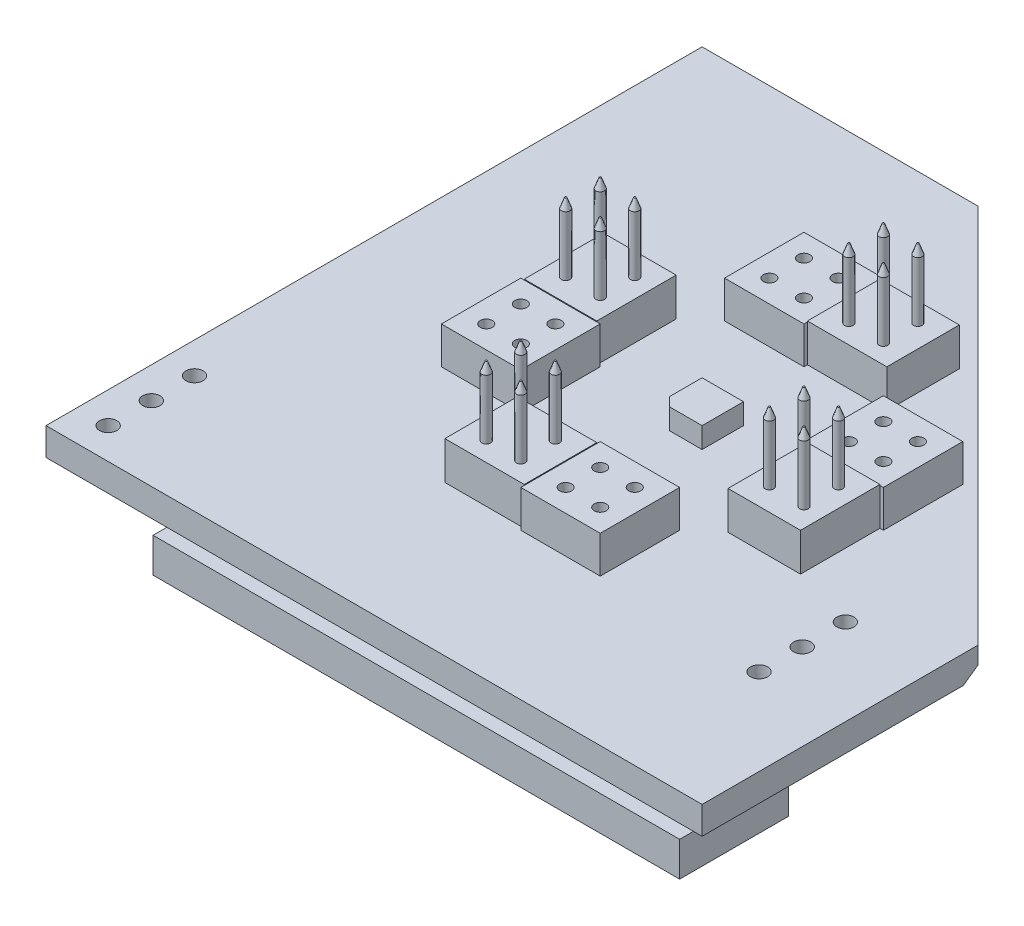
from build123d import *
from OCP.BRepFilletAPI import BRepFilletAPI_MakeChamfer
from build123d.topology import SkipClean

# Parameters (mm, degrees)
EXTRUDE1_DEPTH       = 1.6
SKETCH2_W            = 4.6
SKETCH2_H            = 4.6
EXTRUDE2_DEPTH       = 2.15
SKETCH3_W            = 4.6
SKETCH3_H            = 4.2
SKETCH3_W_2          = 4.2
SKETCH3_H_2          = 4.6
EXTRUDE3_DEPTH       = 2.2
SKETCH4_R            = 0.35
CUT_EXTRUDE1_DEPTH   = 2.15
SKETCH5_R            = 0.25
EXTRUDE4_DEPTH       = 4
CHAMFER1_SIZE        = 0.2
CHAMFER1_SIZE2       = 0.549495484
SKETCH6_W            = 30.5
SKETCH6_H            = 6.3
EXTRUDE5_DEPTH       = 2
CHAMFER2_SIZE        = 0.6
EXTRUDE7_DEPTH       = 1.2
SKETCH14_R           = 0.5
CUT_EXTRUDE2_DEPTH   = 29.528582159
EXTRUDE13_DEPTH      = 0.05
EXTRUDE13_DEPTH_BACK = 1.05
SKETCH15_R           = 0.95
SKETCH15_R_2         = 0.5
SKETCH21_W           = 3.25
SKETCH21_H           = 3.25
EXTRUDE19_DEPTH      = 1.1
SKETCH22_W           = 0.8
SKETCH22_H           = 1.6
SKETCH22_W_2         = 2
SKETCH22_H_2         = 1.3
EXTRUDE20_DEPTH      = 0.5


with BuildPart() as part:
    # Sketch1 → Extrude1 (new body)
    with BuildSketch(Plane(origin=(0, 0, 0), x_dir=(1, 0, 0), z_dir=(0, 1, 0))):
        Polygon((19, -3.019386745), (-3.019386745, 19), (-19, 19), (-19, -19), (19, -19), align=None)
    extrude(amount=EXTRUDE1_DEPTH)

    # Sketch2 → Extrude2 (add)
    with BuildSketch(Plane(origin=(0, 1.6, 0), x_dir=(-1, 0, 0), z_dir=(0, 1, 0))):
        with Locations((-8.2, -2.3)):
            Rectangle(SKETCH2_W, SKETCH2_H)
        with Locations((2.3, -8.2)):
            Rectangle(SKETCH2_W, SKETCH2_H)
        with Locations((-2.3, 8.2)):
            Rectangle(SKETCH2_W, SKETCH2_H)
        with Locations((8.2, 2.3)):
            Rectangle(SKETCH2_W, SKETCH2_H)
    extrude(amount=EXTRUDE2_DEPTH)

    # Sketch3 → Extrude3 (add)
    with BuildSketch(Plane(origin=(0, 1.6, 0), x_dir=(-1, 0, 0), z_dir=(0, 1, 0))):
        with Locations((-2.3, -8.2)):
            Rectangle(SKETCH3_W, SKETCH3_H)
        with Locations((-8.2, 2.3)):
            Rectangle(SKETCH3_W_2, SKETCH3_H_2)
        with Locations((2.3, 8.2)):
            Rectangle(SKETCH3_W, SKETCH3_H)
        with Locations((8.2, -2.3)):
            Rectangle(SKETCH3_W_2, SKETCH3_H_2)
    extrude(amount=EXTRUDE3_DEPTH)

    # Sketch4 → Cut-Extrude1 (cut)
    with BuildSketch(Plane(origin=(0, 3.75, 0), x_dir=(-1, 0, 0), z_dir=(0, 1, 0))):
        with Locations(Location((3.3, -9.2, 0), (0, 0, 90))):
            Circle(SKETCH4_R)
        with Locations(Location((1.3, -9.2, 0), (0, 0, 90))):
            Circle(SKETCH4_R)
        with Locations(Location((1.3, -7.2, 0), (0, 0, 90))):
            Circle(SKETCH4_R)
        with Locations(Location((3.3, -7.2, 0), (0, 0, 90))):
            Circle(SKETCH4_R)
        with Locations(Location((-9.2, -3.3, 0), (0, 0, 90))):
            Circle(SKETCH4_R)
        with Locations(Location((-9.2, -1.3, 0), (0, 0, 90))):
            Circle(SKETCH4_R)
        with Locations(Location((-7.2, -1.3, 0), (0, 0, 90))):
            Circle(SKETCH4_R)
        with Locations(Location((-7.2, -3.3, 0), (0, 0, 90))):
            Circle(SKETCH4_R)
        with Locations(Location((-3.3, 9.2, 0), (0, 0, 90))):
            Circle(SKETCH4_R)
        with Locations(Location((-1.3, 9.2, 0), (0, 0, 90))):
            Circle(SKETCH4_R)
        with Locations(Location((-1.3, 7.2, 0), (0, 0, 90))):
            Circle(SKETCH4_R)
        with Locations(Location((-3.3, 7.2, 0), (0, 0, 90))):
            Circle(SKETCH4_R)
        with Locations(Location((9.2, 3.3, 0), (0, 0, 90))):
            Circle(SKETCH4_R)
        with Locations(Location((9.2, 1.3, 0), (0, 0, 90))):
            Circle(SKETCH4_R)
        with Locations(Location((7.2, 1.3, 0), (0, 0, 90))):
            Circle(SKETCH4_R)
        with Locations(Location((7.2, 3.3, 0), (0, 0, 90))):
            Circle(SKETCH4_R)
    extrude(amount=-CUT_EXTRUDE1_DEPTH, mode=Mode.SUBTRACT)

    # Sketch5 → Extrude4 (add)
    with BuildSketch(Plane(origin=(0, 3.8, 0), x_dir=(-1, 0, 0), z_dir=(0, 1, 0))):
        with Locations(Location((-1.3, -9.2, 0), (0, 0, 270))):
            Circle(SKETCH5_R)
        with Locations(Location((-3.3, -9.2, 0), (0, 0, 270))):
            Circle(SKETCH5_R)
        with Locations(Location((-3.3, -7.2, 0), (0, 0, 270))):
            Circle(SKETCH5_R)
        with Locations(Location((-1.3, -7.2, 0), (0, 0, 270))):
            Circle(SKETCH5_R)
        with Locations(Location((-7.2, 1.3, 0), (0, 0, 270))):
            Circle(SKETCH5_R)
        with Locations(Location((-9.2, 1.3, 0), (0, 0, 90))):
            Circle(SKETCH5_R)
        with Locations(Location((-9.2, 3.3, 0), (0, 0, 270))):
            Circle(SKETCH5_R)
        with Locations(Location((-7.2, 3.3, 0), (0, 0, 90))):
            Circle(SKETCH5_R)
        with Locations(Location((1.3, 7.2, 0), (0, 0, 270))):
            Circle(SKETCH5_R)
        with Locations(Location((1.3, 9.2, 0), (0, 0, 90))):
            Circle(SKETCH5_R)
        with Locations(Location((3.3, 9.2, 0), (0, 0, 270))):
            Circle(SKETCH5_R)
        with Locations(Location((3.3, 7.2, 0), (0, 0, 90))):
            Circle(SKETCH5_R)
        with Locations(Location((7.2, -1.3, 0), (0, 0, 270))):
            Circle(SKETCH5_R)
        with Locations(Location((9.2, -1.3, 0), (0, 0, 90))):
            Circle(SKETCH5_R)
        with Locations(Location((9.2, -3.3, 0), (0, 0, 270))):
            Circle(SKETCH5_R)
        with Locations(Location((7.2, -3.3, 0), (0, 0, 90))):
            Circle(SKETCH5_R)
    extrude(amount=EXTRUDE4_DEPTH)

    # Chamfer1: one chamfer whose edges measure the first distance from different faces: ONE call of the kernel's chamfer builder (chamfer() names one face for all edges)
    chamfer1_edges_1 = [part.edges().sort_by_distance(p)[0] for p in [
        (1.3, 7.8, -8.95),
    ]]
    chamfer1_side_1 = [part.faces().sort_by_distance(p)[0] for p in [
        (1.3, 7.8, -9.2),
    ]]
    chamfer1_edges_2 = [part.edges().sort_by_distance(p)[0] for p in [
        (3.3, 7.8, -8.95),
    ]]
    chamfer1_side_2 = [part.faces().sort_by_distance(p)[0] for p in [
        (3.3, 7.8, -9.2),
    ]]
    chamfer1_edges_3 = [part.edges().sort_by_distance(p)[0] for p in [
        (3.3, 7.8, -6.95),
    ]]
    chamfer1_side_3 = [part.faces().sort_by_distance(p)[0] for p in [
        (3.3, 7.8, -7.2),
    ]]
    chamfer1_edges_4 = [part.edges().sort_by_distance(p)[0] for p in [
        (1.3, 7.8, -6.95),
    ]]
    chamfer1_side_4 = [part.faces().sort_by_distance(p)[0] for p in [
        (1.3, 7.8, -7.2),
    ]]
    chamfer1_edges_5 = [part.edges().sort_by_distance(p)[0] for p in [
        (9.2, 7.8, 1.05),
    ]]
    chamfer1_side_5 = [part.faces().sort_by_distance(p)[0] for p in [
        (9.2, 7.8, 1.3),
    ]]
    chamfer1_edges_6 = [part.edges().sort_by_distance(p)[0] for p in [
        (9.2, 7.8, 3.55),
    ]]
    chamfer1_side_6 = [part.faces().sort_by_distance(p)[0] for p in [
        (9.2, 7.8, 3.3),
    ]]
    chamfer1_edges_7 = [part.edges().sort_by_distance(p)[0] for p in [
        (7.2, 7.8, 3.05),
    ]]
    chamfer1_side_7 = [part.faces().sort_by_distance(p)[0] for p in [
        (7.2, 7.8, 3.3),
    ]]
    chamfer1_edges_8 = [part.edges().sort_by_distance(p)[0] for p in [
        (7.2, 7.8, 1.55),
    ]]
    chamfer1_side_8 = [part.faces().sort_by_distance(p)[0] for p in [
        (7.2, 7.8, 1.3),
    ]]
    chamfer1_edges_9 = [part.edges().sort_by_distance(p)[0] for p in [
        (-1.3, 7.8, 8.95),
    ]]
    chamfer1_side_9 = [part.faces().sort_by_distance(p)[0] for p in [
        (-1.3, 7.8, 9.2),
    ]]
    chamfer1_edges_10 = [part.edges().sort_by_distance(p)[0] for p in [
        (-3.3, 7.8, 9.45),
    ]]
    chamfer1_side_10 = [part.faces().sort_by_distance(p)[0] for p in [
        (-3.3, 7.8, 9.2),
    ]]
    chamfer1_edges_11 = [part.edges().sort_by_distance(p)[0] for p in [
        (-3.3, 7.8, 6.95),
    ]]
    chamfer1_side_11 = [part.faces().sort_by_distance(p)[0] for p in [
        (-3.3, 7.8, 7.2),
    ]]
    chamfer1_edges_12 = [part.edges().sort_by_distance(p)[0] for p in [
        (-1.3, 7.8, 7.45),
    ]]
    chamfer1_side_12 = [part.faces().sort_by_distance(p)[0] for p in [
        (-1.3, 7.8, 7.2),
    ]]
    chamfer1_edges_13 = [part.edges().sort_by_distance(p)[0] for p in [
        (-9.2, 7.8, -1.55),
    ]]
    chamfer1_side_13 = [part.faces().sort_by_distance(p)[0] for p in [
        (-9.2, 7.8, -1.3),
    ]]
    chamfer1_edges_14 = [part.edges().sort_by_distance(p)[0] for p in [
        (-9.2, 7.8, -3.05),
    ]]
    chamfer1_side_14 = [part.faces().sort_by_distance(p)[0] for p in [
        (-9.2, 7.8, -3.3),
    ]]
    chamfer1_edges_15 = [part.edges().sort_by_distance(p)[0] for p in [
        (-7.2, 7.8, -3.55),
    ]]
    chamfer1_side_15 = [part.faces().sort_by_distance(p)[0] for p in [
        (-7.2, 7.8, -3.3),
    ]]
    chamfer1_edges_16 = [part.edges().sort_by_distance(p)[0] for p in [
        (-7.2, 7.8, -1.05),
    ]]
    chamfer1_side_16 = [part.faces().sort_by_distance(p)[0] for p in [
        (-7.2, 7.8, -1.3),
    ]]
    chamfer1 = BRepFilletAPI_MakeChamfer(part.part.solid().wrapped)
    for e in chamfer1_edges_1:
        chamfer1.Add(CHAMFER1_SIZE, CHAMFER1_SIZE2, e.wrapped, chamfer1_side_1[0].wrapped)  # the first distance lies on this face
    for e in chamfer1_edges_2:
        chamfer1.Add(CHAMFER1_SIZE, CHAMFER1_SIZE2, e.wrapped, chamfer1_side_2[0].wrapped)  # the first distance lies on this face
    for e in chamfer1_edges_3:
        chamfer1.Add(CHAMFER1_SIZE, CHAMFER1_SIZE2, e.wrapped, chamfer1_side_3[0].wrapped)  # the first distance lies on this face
    for e in chamfer1_edges_4:
        chamfer1.Add(CHAMFER1_SIZE, CHAMFER1_SIZE2, e.wrapped, chamfer1_side_4[0].wrapped)  # the first distance lies on this face
    for e in chamfer1_edges_5:
        chamfer1.Add(CHAMFER1_SIZE, CHAMFER1_SIZE2, e.wrapped, chamfer1_side_5[0].wrapped)  # the first distance lies on this face
    for e in chamfer1_edges_6:
        chamfer1.Add(CHAMFER1_SIZE, CHAMFER1_SIZE2, e.wrapped, chamfer1_side_6[0].wrapped)  # the first distance lies on this face
    for e in chamfer1_edges_7:
        chamfer1.Add(CHAMFER1_SIZE, CHAMFER1_SIZE2, e.wrapped, chamfer1_side_7[0].wrapped)  # the first distance lies on this face
    for e in chamfer1_edges_8:
        chamfer1.Add(CHAMFER1_SIZE, CHAMFER1_SIZE2, e.wrapped, chamfer1_side_8[0].wrapped)  # the first distance lies on this face
    for e in chamfer1_edges_9:
        chamfer1.Add(CHAMFER1_SIZE, CHAMFER1_SIZE2, e.wrapped, chamfer1_side_9[0].wrapped)  # the first distance lies on this face
    for e in chamfer1_edges_10:
        chamfer1.Add(CHAMFER1_SIZE, CHAMFER1_SIZE2, e.wrapped, chamfer1_side_10[0].wrapped)  # the first distance lies on this face
    for e in chamfer1_edges_11:
        chamfer1.Add(CHAMFER1_SIZE, CHAMFER1_SIZE2, e.wrapped, chamfer1_side_11[0].wrapped)  # the first distance lies on this face
    for e in chamfer1_edges_12:
        chamfer1.Add(CHAMFER1_SIZE, CHAMFER1_SIZE2, e.wrapped, chamfer1_side_12[0].wrapped)  # the first distance lies on this face
    for e in chamfer1_edges_13:
        chamfer1.Add(CHAMFER1_SIZE, CHAMFER1_SIZE2, e.wrapped, chamfer1_side_13[0].wrapped)  # the first distance lies on this face
    for e in chamfer1_edges_14:
        chamfer1.Add(CHAMFER1_SIZE, CHAMFER1_SIZE2, e.wrapped, chamfer1_side_14[0].wrapped)  # the first distance lies on this face
    for e in chamfer1_edges_15:
        chamfer1.Add(CHAMFER1_SIZE, CHAMFER1_SIZE2, e.wrapped, chamfer1_side_15[0].wrapped)  # the first distance lies on this face
    for e in chamfer1_edges_16:
        chamfer1.Add(CHAMFER1_SIZE, CHAMFER1_SIZE2, e.wrapped, chamfer1_side_16[0].wrapped)  # the first distance lies on this face
    add(Compound.cast(chamfer1.Shape()), mode=Mode.REPLACE)

    # Sketch6 → Extrude5 (add)
    with BuildSketch(Plane.XZ):
        with Locations((3.25, 16.65)):
            Rectangle(SKETCH6_W, SKETCH6_H)
    extrude(amount=EXTRUDE5_DEPTH)

    # Chamfer2
    chamfer2_edges = [part.edges().sort_by_distance(p)[0] for p in [
        (7.990306627, 0, -7.990306627),
    ]]
    chamfer(chamfer2_edges, length=CHAMFER2_SIZE)

    # Sketch8 → Extrude7 (add)
    with BuildSketch(Plane(origin=(0, 1.6, 0), x_dir=(-1, 0, 0), z_dir=(0, 1, 0))):
        Polygon((1.2, 0.7), (0.7, 1.2), (-1.2, 1.2), (-1.2, -1.2), (1.2, -1.2), align=None)
    extrude(amount=EXTRUDE7_DEPTH)

    # Sketch14 → Cut-Extrude2 (cut, through all)
    with BuildSketch(Plane.XZ):
        with Locations(Location((-17.2, 17.2, 0), (0, 0, 270))):
            Circle(SKETCH14_R)
        with Locations(Location((-17.2, 14.7, 0), (0, 0, 270))):
            Circle(SKETCH14_R)
        with Locations(Location((-17.2, 12.2, 0), (0, 0, 270))):
            Circle(SKETCH14_R)
        with Locations(Location((14, 8.2, 0), (0, 0, 90))):
            Circle(SKETCH14_R)
        with Locations(Location((14, 5.7, 0), (0, 0, 90))):
            Circle(SKETCH14_R)
        with Locations(Location((14, 10.7, 0), (0, 0, 90))):
            Circle(SKETCH14_R)
    extrude(amount=-CUT_EXTRUDE2_DEPTH, mode=Mode.SUBTRACT)

    # Sketch15 → Extrude13 (add, two sides: drawn at the far end of the back side and taken through both)
    # profile 1 of 6: a face of its own
    with SkipClean():  # the faces are left unmerged after this step: merging them gives an invalid solid
        with BuildSketch(Plane.XZ.offset(-EXTRUDE13_DEPTH_BACK)):
            with Locations(Location((14, 10.7, 0), (0, 0, 90))):
                Circle(SKETCH15_R)
            with Locations(Location((14, 10.7, 0), (0, 0, 270))):
                Circle(SKETCH15_R_2, mode=Mode.SUBTRACT)
        # profile 2 of 6: a face of its own
        with BuildSketch(Plane.XZ.offset(-EXTRUDE13_DEPTH_BACK)):
            with Locations(Location((14, 8.2, 0), (0, 0, 90))):
                Circle(SKETCH15_R)
            with Locations(Location((14, 8.2, 0), (0, 0, 270))):
                Circle(SKETCH15_R_2, mode=Mode.SUBTRACT)
        # profile 3 of 6: a face of its own
        with BuildSketch(Plane.XZ.offset(-EXTRUDE13_DEPTH_BACK)):
            with Locations(Location((14, 5.7, 0), (0, 0, 90))):
                Circle(SKETCH15_R)
            with Locations(Location((14, 5.7, 0), (0, 0, 270))):
                Circle(SKETCH15_R_2, mode=Mode.SUBTRACT)
        # profile 4 of 6: a face of its own
        with BuildSketch(Plane.XZ.offset(-EXTRUDE13_DEPTH_BACK)):
            with Locations(Location((-17.2, 17.2, 0), (0, 0, 90))):
                Circle(SKETCH15_R)
            with Locations(Location((-17.2, 17.2, 0), (0, 0, 270))):
                Circle(SKETCH15_R_2, mode=Mode.SUBTRACT)
        # profile 5 of 6: a face of its own
        with BuildSketch(Plane.XZ.offset(-EXTRUDE13_DEPTH_BACK)):
            with Locations(Location((-17.2, 14.7, 0), (0, 0, 90))):
                Circle(SKETCH15_R)
            with Locations(Location((-17.2, 14.7, 0), (0, 0, 270))):
                Circle(SKETCH15_R_2, mode=Mode.SUBTRACT)
        # profile 6 of 6: a face of its own
        with BuildSketch(Plane.XZ.offset(-EXTRUDE13_DEPTH_BACK)):
            with Locations(Location((-17.2, 12.2, 0), (0, 0, 90))):
                Circle(SKETCH15_R)
            with Locations(Location((-17.2, 12.2, 0), (0, 0, 270))):
                Circle(SKETCH15_R_2, mode=Mode.SUBTRACT)
        extrude(amount=EXTRUDE13_DEPTH + EXTRUDE13_DEPTH_BACK)
    add(part.part.scale(1), mode=Mode.REPLACE)  # the faces are merged on a copy

    # Sketch21 → Extrude19 (add)
    with BuildSketch(Plane.XZ):
        with Locations((2.475, 3.825)):
            Rectangle(SKETCH21_W, SKETCH21_H)
    extrude(amount=EXTRUDE19_DEPTH)

    # Sketch22 → Extrude20 (add)
    with BuildSketch(Plane.XZ):
        with Locations((11.85, 10.1)):
            Rectangle(SKETCH22_W, SKETCH22_H)
        with Locations((11.85, 6.6)):
            Rectangle(SKETCH22_W, SKETCH22_H)
        with Locations((5.05, -1.45)):
            Rectangle(SKETCH22_W, SKETCH22_H)
        with Locations((3.55, -1.45)):
            Rectangle(SKETCH22_W, SKETCH22_H)
        with Locations((0.25, -0.95)):
            Rectangle(SKETCH22_W, SKETCH22_H)
        with Locations((7, 2.85)):
            Rectangle(SKETCH22_W_2, SKETCH22_H_2)
    extrude(amount=EXTRUDE20_DEPTH)


solid = part.part
